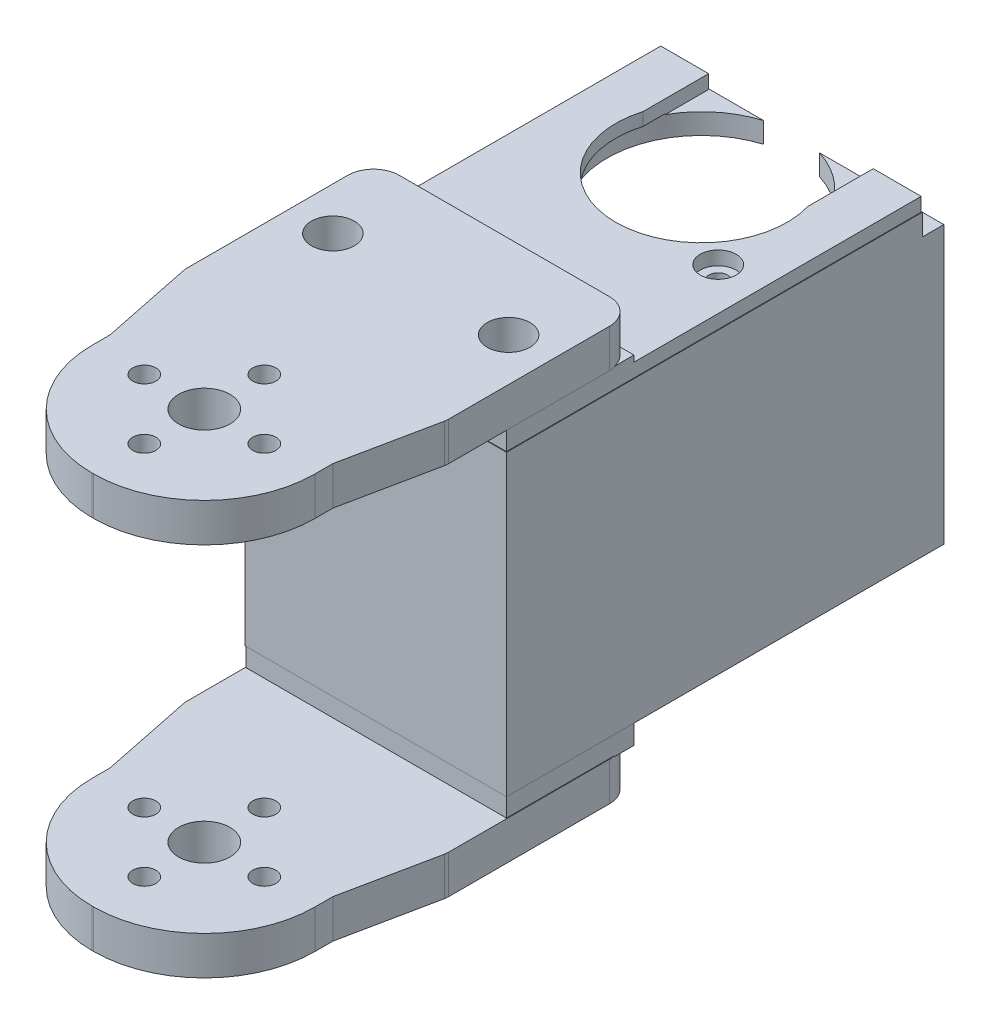
from build123d import *

# Parameters (mm, degrees)
BOSS_1_DEPTH    = 4.5
S_CYL2_R        = 9
BOSS_2_DEPTH    = 2
BOSS_3_DEPTH    = 4.5
S_BOX4_W        = 30.52
S_BOX4_H        = 34.8
BOSS_4_DEPTH    = 2.5
S_BOX5_W        = 2.5
S_BOX5_H        = 34.8
BOSS_5_DEPTH    = 51.02
S_BOX6_W        = 30.52
S_BOX6_H        = 2.4
BOSS_6_DEPTH    = 51.02
S_BOX7_W        = 2.5
S_BOX7_H        = 34.8
BOSS_7_DEPTH    = 18.01
S_BOX8_W        = 30.38
S_BOX8_H        = 2.675
BOSS_8_DEPTH    = 14.87
S_BOX9_W        = 30.38
S_BOX9_H        = 2.425
BOSS_9_DEPTH    = 14.87
S_BOX10_W       = 30.38
S_BOX10_H       = 1.65
BOSS_10_DEPTH   = 37.94
S_BOX11_W       = 5.59
S_BOX11_H       = 1.65
BOSS_11_DEPTH   = 10.54
S_BOX12_W       = 5.59
S_BOX12_H       = 1.65
BOSS_12_DEPTH   = 10.54
S_HOLE13_R      = 3
HOLE_13_DEPTH   = 4.7
S_HOLE14_R      = 1.35
HOLE_14_DEPTH   = 4.7
S_HOLE15_R      = 1.35
HOLE_15_DEPTH   = 4.7
S_HOLE16_R      = 1.35
HOLE_16_DEPTH   = 4.7
S_HOLE17_R      = 1.35
HOLE_17_DEPTH   = 4.7
S_HOLE18_R      = 3
HOLE_18_DEPTH   = 6.7
S_HOLE19_R      = 1.35
HOLE_19_DEPTH   = 6.7
S_HOLE20_R      = 1.35
HOLE_20_DEPTH   = 6.7
S_HOLE21_R      = 1.35
HOLE_21_DEPTH   = 6.7
S_HOLE22_R      = 1.35
HOLE_22_DEPTH   = 6.7
S_HOLE23_R      = 11
HOLE_23_DEPTH   = 2.6
S_HOLE24_R      = 1.1
HOLE_24_DEPTH   = 2.6
S_HOLE25_R      = 1.1
HOLE_25_DEPTH   = 2.6
S_HOLE26_R      = 1.1
HOLE_26_DEPTH   = 2.6
S_CUT27_W       = 30.72
S_CUT27_H       = 2.6
POCKET_27_DEPTH = 2.6
S_HOLE28_R      = 2.5
HOLE_28_DEPTH   = 5.175
S_HOLE29_R      = 2.5
HOLE_29_DEPTH   = 5.175
S_HOLE30_R      = 10
HOLE_30_DEPTH   = 1.8
S_HOLE31_R      = 1.1
HOLE_31_DEPTH   = 1.8
S_HOLE32_R      = 2.1
HOLE_32_DEPTH   = 1.7
S_HOLE33_R      = 1.1
HOLE_33_DEPTH   = 1.8
S_HOLE34_R      = 2.1
HOLE_34_DEPTH   = 1.7
S_HOLE35_R      = 1.1
HOLE_35_DEPTH   = 1.8
S_HOLE36_R      = 2.1
HOLE_36_DEPTH   = 1.7


with BuildPart() as part:
    # S_prism1 → Boss_1 (new body)
    with BuildSketch(Plane(origin=(0, -23.125, 0), x_dir=(1, 0, 0), z_dir=(0, 1, 0))):
        with BuildLine():
            Line((-13, 2), (-15.2191, 12.8008))
            ThreePointArc((-15.2191, 12.8008), (-15.249701872, 13.001018419), (-15.26, 13.2033))
            Line((-15.26, 13.2033), (-15.26, 32))
            ThreePointArc((-15.26, 32), (-14.3813, 34.1213), (-12.26, 35))
            Line((-12.26, 35), (12.26, 35))
            ThreePointArc((12.26, 35), (14.3813, 34.1213), (15.26, 32))
            Line((15.26, 32), (15.26, 13.2033))
            ThreePointArc((15.26, 13.2033), (15.249701872, 13.001018419), (15.2191, 12.8008))
            Line((15.2191, 12.8008), (13, 2))
            Line((13, 2), (13, -0.1))
            ThreePointArc((13, -0.1), (9.2217, -9.2217), (0.1, -13))
            Line((0.1, -13), (-0.1, -13))
            ThreePointArc((-0.1, -13), (-9.2217, -9.2217), (-13, -0.1))
            Line((-13, -0.1), (-13, 2))
        make_face()
    extrude(amount=BOSS_1_DEPTH)



with BuildPart() as body_2:
    # S_cyl2 → Boss_2 (new body)
    with BuildSketch(Plane(origin=(0, 18.625, 0), x_dir=(1, 0, 0), z_dir=(0, 1, 0))):
        Circle(S_CYL2_R)
    extrude(amount=BOSS_2_DEPTH)

    # S_prism3 → Boss_3 (add)
    with BuildSketch(Plane(origin=(0, 20.625, 0), x_dir=(1, 0, 0), z_dir=(0, 1, 0))):
        with BuildLine():
            Line((-13, 2), (-15.2191, 12.8008))
            ThreePointArc((-15.2191, 12.8008), (-15.249701872, 13.001018419), (-15.26, 13.2033))
            Line((-15.26, 13.2033), (-15.26, 32))
            ThreePointArc((-15.26, 32), (-14.3813, 34.1213), (-12.26, 35))
            Line((-12.26, 35), (12.26, 35))
            ThreePointArc((12.26, 35), (14.3813, 34.1213), (15.26, 32))
            Line((15.26, 32), (15.26, 13.2033))
            ThreePointArc((15.26, 13.2033), (15.249701872, 13.001018419), (15.2191, 12.8008))
            Line((15.2191, 12.8008), (13, 2))
            Line((13, 2), (13, -0.1))
            ThreePointArc((13, -0.1), (9.2217, -9.2217), (0.1, -13))
            Line((0.1, -13), (-0.1, -13))
            ThreePointArc((-0.1, -13), (-9.2217, -9.2217), (-13, -0.1))
            Line((-13, -0.1), (-13, 2))
        make_face()
    extrude(amount=BOSS_3_DEPTH)


with BuildPart() as body_3:
    # S_box4 → Boss_4 (new body)
    with BuildSketch(Plane.XY.offset(-22.49)):
        with Locations((0, 1)):
            Rectangle(S_BOX4_W, S_BOX4_H)
    extrude(amount=BOSS_4_DEPTH)

    # S_box5 → Boss_5 (add)
    with BuildSketch(Plane.XY.offset(-71.01)):
        with Locations((14.01, 1)):
            Rectangle(S_BOX5_W, S_BOX5_H)
    extrude(amount=BOSS_5_DEPTH)

    # S_box6 → Boss_6 (add)
    with BuildSketch(Plane.XY.offset(-71.01)):
        with Locations((0, 17.2)):
            Rectangle(S_BOX6_W, S_BOX6_H)
    extrude(amount=BOSS_6_DEPTH)

    # S_box7 → Boss_7 (add)
    with BuildSketch(Plane.XY.offset(-38)):
        with Locations((-14.01, 1)):
            Rectangle(S_BOX7_W, S_BOX7_H)
    extrude(amount=BOSS_7_DEPTH)


with BuildPart() as part_1:
    add(part.part)

    add(body_3.part)  # Boss_8 merges body 3
    # S_box8 → Boss_8 (add)
    with BuildSketch(Plane.XY.offset(-34.93)):
        with Locations((0, -17.3875)):
            Rectangle(S_BOX8_W, S_BOX8_H)
    extrude(amount=BOSS_8_DEPTH)


    add(body_2.part)  # Boss_9 merges body 2
    # S_box9 → Boss_9 (add)
    with BuildSketch(Plane.XY.offset(-34.93)):
        with Locations((0, 19.5125)):
            Rectangle(S_BOX9_W, S_BOX9_H)
    extrude(amount=BOSS_9_DEPTH)

    # S_box10 → Boss_10 (add)
    with BuildSketch(Plane.XY.offset(-58)):
        with Locations((0, 19.175)):
            Rectangle(S_BOX10_W, S_BOX10_H)
    extrude(amount=BOSS_10_DEPTH)

    # S_box11 → Boss_11 (add)
    with BuildSketch(Plane.XY.offset(-68.44)):
        with Locations((-12.395, 19.175)):
            Rectangle(S_BOX11_W, S_BOX11_H)
    extrude(amount=BOSS_11_DEPTH)

    # S_box12 → Boss_12 (add)
    with BuildSketch(Plane.XY.offset(-68.44)):
        with Locations((12.395, 19.175)):
            Rectangle(S_BOX12_W, S_BOX12_H)
    extrude(amount=BOSS_12_DEPTH)

    # S_hole13 → Hole_13 (cut)
    with BuildSketch(Plane(origin=(0, -23.225, 0), x_dir=(1, 0, 0), z_dir=(0, 1, 0))):
        Circle(S_HOLE13_R)
    extrude(amount=HOLE_13_DEPTH, mode=Mode.SUBTRACT)

    # S_hole14 → Hole_14 (cut)
    with BuildSketch(Plane(origin=(0, -23.225, 0), x_dir=(1, 0, 0), z_dir=(0, 1, 0))):
        with Locations((7, 0)):
            Circle(S_HOLE14_R)
    extrude(amount=HOLE_14_DEPTH, mode=Mode.SUBTRACT)

    # S_hole15 → Hole_15 (cut)
    with BuildSketch(Plane(origin=(0, -23.225, 0), x_dir=(1, 0, 0), z_dir=(0, 1, 0))):
        with Locations((0, -7)):
            Circle(S_HOLE15_R)
    extrude(amount=HOLE_15_DEPTH, mode=Mode.SUBTRACT)

    # S_hole16 → Hole_16 (cut)
    with BuildSketch(Plane(origin=(0, -23.225, 0), x_dir=(1, 0, 0), z_dir=(0, 1, 0))):
        with Locations((-7, 0)):
            Circle(S_HOLE16_R)
    extrude(amount=HOLE_16_DEPTH, mode=Mode.SUBTRACT)

    # S_hole17 → Hole_17 (cut)
    with BuildSketch(Plane(origin=(0, -23.225, 0), x_dir=(1, 0, 0), z_dir=(0, 1, 0))):
        with Locations((0, 7)):
            Circle(S_HOLE17_R)
    extrude(amount=HOLE_17_DEPTH, mode=Mode.SUBTRACT)

    # S_hole18 → Hole_18 (cut)
    with BuildSketch(Plane(origin=(0, 18.525, 0), x_dir=(1, 0, 0), z_dir=(0, 1, 0))):
        Circle(S_HOLE18_R)
    extrude(amount=HOLE_18_DEPTH, mode=Mode.SUBTRACT)

    # S_hole19 → Hole_19 (cut)
    with BuildSketch(Plane(origin=(0, 18.525, 0), x_dir=(1, 0, 0), z_dir=(0, 1, 0))):
        with Locations((7, 0)):
            Circle(S_HOLE19_R)
    extrude(amount=HOLE_19_DEPTH, mode=Mode.SUBTRACT)

    # S_hole20 → Hole_20 (cut)
    with BuildSketch(Plane(origin=(0, 18.525, 0), x_dir=(1, 0, 0), z_dir=(0, 1, 0))):
        with Locations((0, -7)):
            Circle(S_HOLE20_R)
    extrude(amount=HOLE_20_DEPTH, mode=Mode.SUBTRACT)

    # S_hole21 → Hole_21 (cut)
    with BuildSketch(Plane(origin=(0, 18.525, 0), x_dir=(1, 0, 0), z_dir=(0, 1, 0))):
        with Locations((-7, 0)):
            Circle(S_HOLE21_R)
    extrude(amount=HOLE_21_DEPTH, mode=Mode.SUBTRACT)

    # S_hole22 → Hole_22 (cut)
    with BuildSketch(Plane(origin=(0, 18.525, 0), x_dir=(1, 0, 0), z_dir=(0, 1, 0))):
        with Locations((0, 7)):
            Circle(S_HOLE22_R)
    extrude(amount=HOLE_22_DEPTH, mode=Mode.SUBTRACT)

    # S_hole23 → Hole_23 (cut)
    with BuildSketch(Plane(origin=(0, 15.9, 0), x_dir=(1, 0, 0), z_dir=(0, 1, 0))):
        with Locations((0, 58)):
            Circle(S_HOLE23_R)
    extrude(amount=HOLE_23_DEPTH, mode=Mode.SUBTRACT)

    # S_hole24 → Hole_24 (cut)
    with BuildSketch(Plane(origin=(0, 15.9, 0), x_dir=(1, 0, 0), z_dir=(0, 1, 0))):
        with Locations((10.25, 49.7)):
            Circle(S_HOLE24_R)
    extrude(amount=HOLE_24_DEPTH, mode=Mode.SUBTRACT)

    # S_hole25 → Hole_25 (cut)
    with BuildSketch(Plane(origin=(0, 15.9, 0), x_dir=(1, 0, 0), z_dir=(0, 1, 0))):
        with Locations((-10.25, 25.25)):
            Circle(S_HOLE25_R)
    extrude(amount=HOLE_25_DEPTH, mode=Mode.SUBTRACT)

    # S_hole26 → Hole_26 (cut)
    with BuildSketch(Plane(origin=(0, 15.9, 0), x_dir=(1, 0, 0), z_dir=(0, 1, 0))):
        with Locations((10.25, 25.25)):
            Circle(S_HOLE26_R)
    extrude(amount=HOLE_26_DEPTH, mode=Mode.SUBTRACT)

    # S_cut27 → Pocket_27 (cut)
    with BuildSketch(Plane.XY.offset(-71.11)):
        with Locations((0, 17.2)):
            Rectangle(S_CUT27_W, S_CUT27_H)
    extrude(amount=POCKET_27_DEPTH, mode=Mode.SUBTRACT)

    # S_hole28 → Hole_28 (cut)
    with BuildSketch(Plane(origin=(0, 20.05, 0), x_dir=(1, 0, 0), z_dir=(0, 1, 0))):
        with Locations((-10.25, 25.25)):
            Circle(S_HOLE28_R)
    extrude(amount=HOLE_28_DEPTH, mode=Mode.SUBTRACT)

    # S_hole29 → Hole_29 (cut)
    with BuildSketch(Plane(origin=(0, 20.05, 0), x_dir=(1, 0, 0), z_dir=(0, 1, 0))):
        with Locations((10.25, 25.25)):
            Circle(S_HOLE29_R)
    extrude(amount=HOLE_29_DEPTH, mode=Mode.SUBTRACT)

    # S_hole30 → Hole_30 (cut)
    with BuildSketch(Plane(origin=(0, 18.3, 0), x_dir=(1, 0, 0), z_dir=(0, 1, 0))):
        with Locations((0, 58)):
            Circle(S_HOLE30_R)
    extrude(amount=HOLE_30_DEPTH, mode=Mode.SUBTRACT)

    # S_hole31 → Hole_31 (cut)
    with BuildSketch(Plane(origin=(0, 18.3, 0), x_dir=(1, 0, 0), z_dir=(0, 1, 0))):
        with Locations((10.25, 49.7)):
            Circle(S_HOLE31_R)
    extrude(amount=HOLE_31_DEPTH, mode=Mode.SUBTRACT)

    # S_hole32 → Hole_32 (cut)
    with BuildSketch(Plane(origin=(0, 18.4, 0), x_dir=(1, 0, 0), z_dir=(0, 1, 0))):
        with Locations((10.25, 49.7)):
            Circle(S_HOLE32_R)
    extrude(amount=HOLE_32_DEPTH, mode=Mode.SUBTRACT)

    # S_hole33 → Hole_33 (cut)
    with BuildSketch(Plane(origin=(0, 18.3, 0), x_dir=(1, 0, 0), z_dir=(0, 1, 0))):
        with Locations((-10.25, 25.25)):
            Circle(S_HOLE33_R)
    extrude(amount=HOLE_33_DEPTH, mode=Mode.SUBTRACT)

    # S_hole34 → Hole_34 (cut)
    with BuildSketch(Plane(origin=(0, 18.4, 0), x_dir=(1, 0, 0), z_dir=(0, 1, 0))):
        with Locations((-10.25, 25.25)):
            Circle(S_HOLE34_R)
    extrude(amount=HOLE_34_DEPTH, mode=Mode.SUBTRACT)

    # S_hole35 → Hole_35 (cut)
    with BuildSketch(Plane(origin=(0, 18.3, 0), x_dir=(1, 0, 0), z_dir=(0, 1, 0))):
        with Locations((10.25, 25.25)):
            Circle(S_HOLE35_R)
    extrude(amount=HOLE_35_DEPTH, mode=Mode.SUBTRACT)

    # S_hole36 → Hole_36 (cut)
    with BuildSketch(Plane(origin=(0, 18.4, 0), x_dir=(1, 0, 0), z_dir=(0, 1, 0))):
        with Locations((10.25, 25.25)):
            Circle(S_HOLE36_R)
    extrude(amount=HOLE_36_DEPTH, mode=Mode.SUBTRACT)


solid = part_1.part
